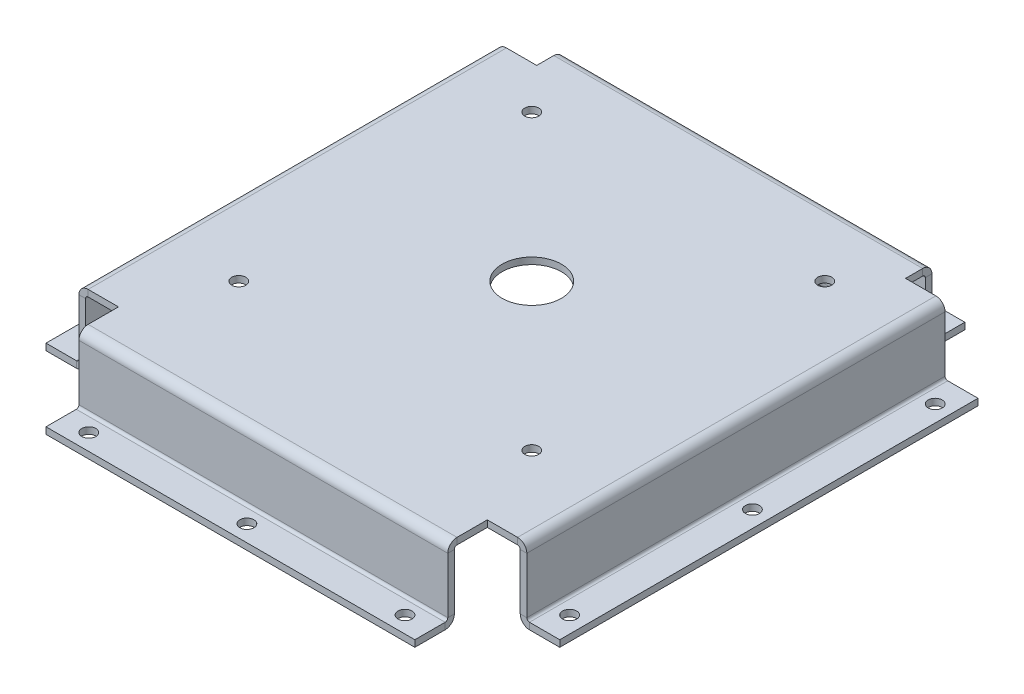
from build123d import *

# Parameters (mm, degrees)
BOSS_EXTRUDE1_DEPTH      = 88.9
BOSS_EXTRUDE1_DEPTH_BACK = 88.9
SKETCH2_R                = 3.3782
CUT_EXTRUDE2_DEPTH       = 163.899847125
SKETCH5_R                = 14.2875
SKETCH5_R_2              = 3.3782
CUT_EXTRUDE3_DEPTH       = 164.564592404
BOSS_EXTRUDE3_START      = -19.05
BOSS_EXTRUDE3_DEPTH      = 201.6125
CONVERT_SOLID1_START     = -88.9
CONVERT_SOLID1_DEPTH     = 177.8
CONVERT_SOLID1_START_2   = -103.98125
CONVERT_SOLID1_2_DEPTH   = 201.6125
CONVERT_SOLID1_3_DEPTH   = 177.8
CONVERT_SOLID1_4_DEPTH   = 201.6125
SKETCH7_R                = 3.3782
CUT_EXTRUDE4_DEPTH       = 185.298076003


# Read off the part's stored shape, not the designer's step: Convert-Solid1
with BuildPart() as part:
    # Sketch1 → Boss-Extrude1 (new, two sides: drawn at the far end of the back side and taken through both)
    with BuildSketch(Plane(origin=(0, 0, 0), x_dir=(0, 0, -1), z_dir=(1, 0, 0)).offset(-BOSS_EXTRUDE1_DEPTH_BACK)):
        Polygon((-132.55625, -29.4132), (-132.55625, -32.5882), (-113.50625, -32.5882), (-113.50625, 0), (113.50625, 0), (113.50625, -32.5882), (132.55625, -32.5882), (132.55625, -29.4132), (116.68125, -29.4132), (116.68125, 3.175), (-116.68125, 3.175), (-116.68125, -29.4132), align=None)
    extrude(amount=BOSS_EXTRUDE1_DEPTH + BOSS_EXTRUDE1_DEPTH_BACK)

    # Sketch2 → Cut-Extrude2 (cut, through all)
    with BuildSketch(Plane(origin=(0, -29.4132, 0), x_dir=(1, 0, 0), z_dir=(0, 1, 0))):
        with Locations(Location((-76.2, -124.61875, 0), (0, 0, 270))):
            Circle(SKETCH2_R)
        with Locations(Location((0, -124.61875, 0), (0, 0, 270))):
            Circle(SKETCH2_R)
        with Locations(Location((76.2, -124.61875, 0), (0, 0, 270))):
            Circle(SKETCH2_R)
        with Locations(Location((76.2, 124.61875, 0), (0, 0, 90))):
            Circle(SKETCH2_R)
        with Locations(Location((0, 124.61875, 0), (0, 0, 90))):
            Circle(SKETCH2_R)
        with Locations(Location((-76.2, 124.61875, 0), (0, 0, 90))):
            Circle(SKETCH2_R)
    extrude(amount=-CUT_EXTRUDE2_DEPTH, mode=Mode.SUBTRACT)

    # Sketch5 → Cut-Extrude3 (cut, through all)
    with BuildSketch(Plane(origin=(0, 3.175, 0), x_dir=(1, 0, 0), z_dir=(0, 1, 0))):
        with Locations(Location((0, 12.7, 0), (0, 0, 270))):
            Circle(SKETCH5_R)
        with Locations(Location((-70.612, 83.312, 0), (0, 0, 270))):
            Circle(SKETCH5_R_2)
        with Locations(Location((70.612, 83.312, 0), (0, 0, 270))):
            Circle(SKETCH5_R_2)
        with Locations(Location((70.612, -57.912, 0), (0, 0, 270))):
            Circle(SKETCH5_R_2)
        with Locations(Location((-70.612, -57.912, 0), (0, 0, 270))):
            Circle(SKETCH5_R_2)
    extrude(amount=-CUT_EXTRUDE3_DEPTH, mode=Mode.SUBTRACT)

    # Sketch6 → Boss-Extrude3 (add)
    with BuildSketch(Plane.XY.offset(116.68125).offset(BOSS_EXTRUDE3_START)):
        Polygon((88.9, 3.175), (107.95, 3.175), (107.95, -29.4132), (123.825, -29.4132), (123.825, -32.5882), (104.775, -32.5882), (104.775, 0), (88.9, 0), align=None)
        Polygon((-88.9, 0), (-88.9, 3.175), (-107.95, 3.175), (-107.95, -29.4132), (-123.825, -29.4132), (-123.825, -32.5882), (-104.775, -32.5882), (-104.775, 0), align=None)
    extrude(amount=-BOSS_EXTRUDE3_DEPTH)

    # Convert-Solid1 outline → Convert-Solid1 (add)
    with BuildSketch(Plane.YZ.offset(CONVERT_SOLID1_START)):
        with BuildLine():
            Line((-29.4132, -116.68125), (-29.4132, -117.95125))
            ThreePointArc((-29.4132, -117.95125), (-29.041225612, -117.053224388), (-28.1432, -116.68125))
            Line((-28.1432, -116.68125), (-29.4132, -116.68125))
        make_face()
        with BuildLine():
            Line((0, -113.50625), (0, -112.23625))
            ThreePointArc((0, -112.23625), (-0.371974388, -113.134275612), (-1.27, -113.50625))
            Line((-1.27, -113.50625), (0, -113.50625))
        make_face()
        with BuildLine():
            ThreePointArc((-1.27, 113.50625), (-0.371974388, 113.134275612), (0, 112.23625))
            Line((0, 112.23625), (0, 113.50625))
            Line((0, 113.50625), (-1.27, 113.50625))
        make_face()
        with BuildLine():
            Line((-29.4132, 116.68125), (-28.1432, 116.68125))
            ThreePointArc((-28.1432, 116.68125), (-29.041225612, 117.053224388), (-29.4132, 117.95125))
            Line((-29.4132, 117.95125), (-29.4132, 116.68125))
        make_face()
    extrude(amount=CONVERT_SOLID1_DEPTH)

    # Convert-Solid1 2 outline → Convert-Solid1 2 (add)
    with BuildSketch(Plane.XY.offset(CONVERT_SOLID1_START_2)):
        with BuildLine():
            Line((107.95, -29.4132), (109.22, -29.4132))
            ThreePointArc((109.22, -29.4132), (108.321974388, -29.041225612), (107.95, -28.1432))
            Line((107.95, -28.1432), (107.95, -29.4132))
        make_face()
        with BuildLine():
            Line((-107.95, -29.4132), (-107.95, -28.1432))
            ThreePointArc((-107.95, -28.1432), (-108.321974388, -29.041225612), (-109.22, -29.4132))
            Line((-109.22, -29.4132), (-107.95, -29.4132))
        make_face()
        with BuildLine():
            ThreePointArc((-104.775, -1.27), (-104.403025612, -0.371974388), (-103.505, 0))
            Line((-103.505, 0), (-104.775, 0))
            Line((-104.775, 0), (-104.775, -1.27))
        make_face()
        with BuildLine():
            ThreePointArc((103.505, 0), (104.403025612, -0.371974388), (104.775, -1.27))
            Line((104.775, -1.27), (104.775, 0))
            Line((104.775, 0), (103.505, 0))
        make_face()
    extrude(amount=CONVERT_SOLID1_2_DEPTH)

    # Convert-Solid1 3 outline → Convert-Solid1 3 (cut)
    with BuildSketch(Plane.YZ.offset(CONVERT_SOLID1_START)):
        with BuildLine():
            ThreePointArc((-32.5882, -117.95125), (-31.286289642, -114.808160358), (-28.1432, -113.50625))
            Line((-28.1432, -113.50625), (-32.5882, -113.50625))
            Line((-32.5882, -113.50625), (-32.5882, -117.95125))
        make_face()
        with BuildLine():
            Line((-32.5882, 113.50625), (-28.1432, 113.50625))
            ThreePointArc((-28.1432, 113.50625), (-31.286289642, 114.808160358), (-32.5882, 117.95125))
            Line((-32.5882, 117.95125), (-32.5882, 113.50625))
        make_face()
        with BuildLine():
            ThreePointArc((-1.27, 116.68125), (1.873089642, 115.379339642), (3.175, 112.23625))
            Line((3.175, 112.23625), (3.175, 116.68125))
            Line((3.175, 116.68125), (-1.27, 116.68125))
        make_face()
        with BuildLine():
            ThreePointArc((3.175, -112.23625), (1.873089642, -115.379339642), (-1.27, -116.68125))
            Line((-1.27, -116.68125), (3.175, -116.68125))
            Line((3.175, -116.68125), (3.175, -112.23625))
        make_face()
    extrude(amount=CONVERT_SOLID1_3_DEPTH, mode=Mode.SUBTRACT)

    # Convert-Solid1 4 outline → Convert-Solid1 4 (cut)
    with BuildSketch(Plane.XY.offset(CONVERT_SOLID1_START_2)):
        with BuildLine():
            ThreePointArc((-107.95, -1.27), (-106.648089642, 1.873089642), (-103.505, 3.175))
            Line((-103.505, 3.175), (-107.95, 3.175))
            Line((-107.95, 3.175), (-107.95, -1.27))
        make_face()
        with BuildLine():
            ThreePointArc((103.505, 3.175), (106.648089642, 1.873089642), (107.95, -1.27))
            Line((107.95, -1.27), (107.95, 3.175))
            Line((107.95, 3.175), (103.505, 3.175))
        make_face()
        with BuildLine():
            Line((104.775, -32.5882), (109.22, -32.5882))
            ThreePointArc((109.22, -32.5882), (106.076910358, -31.286289642), (104.775, -28.1432))
            Line((104.775, -28.1432), (104.775, -32.5882))
        make_face()
        with BuildLine():
            Line((-104.775, -32.5882), (-104.775, -28.1432))
            ThreePointArc((-104.775, -28.1432), (-106.076910358, -31.286289642), (-109.22, -32.5882))
            Line((-109.22, -32.5882), (-104.775, -32.5882))
        make_face()
    extrude(amount=CONVERT_SOLID1_4_DEPTH, mode=Mode.SUBTRACT)

    # Sketch7 → Cut-Extrude4 (cut, through all)
    with BuildSketch(Plane(origin=(0, -29.4132, 0), x_dir=(1, 0, 0), z_dir=(0, 1, 0))):
        with Locations(Location((115.8875, -84.93125, 0), (0, 0, 270))):
            Circle(SKETCH7_R)
        with Locations(Location((115.8875, 3.175, 0), (0, 0, 270))):
            Circle(SKETCH7_R)
        with Locations(Location((115.8875, 91.28125, 0), (0, 0, 270))):
            Circle(SKETCH7_R)
        with Locations(Location((-115.8875, -84.93125, 0), (0, 0, 90))):
            Circle(SKETCH7_R)
        with Locations(Location((-115.8875, 3.175, 0), (0, 0, 90))):
            Circle(SKETCH7_R)
        with Locations(Location((-115.8875, 91.28125, 0), (0, 0, 90))):
            Circle(SKETCH7_R)
    extrude(amount=-CUT_EXTRUDE4_DEPTH, mode=Mode.SUBTRACT)


solid = part.part
